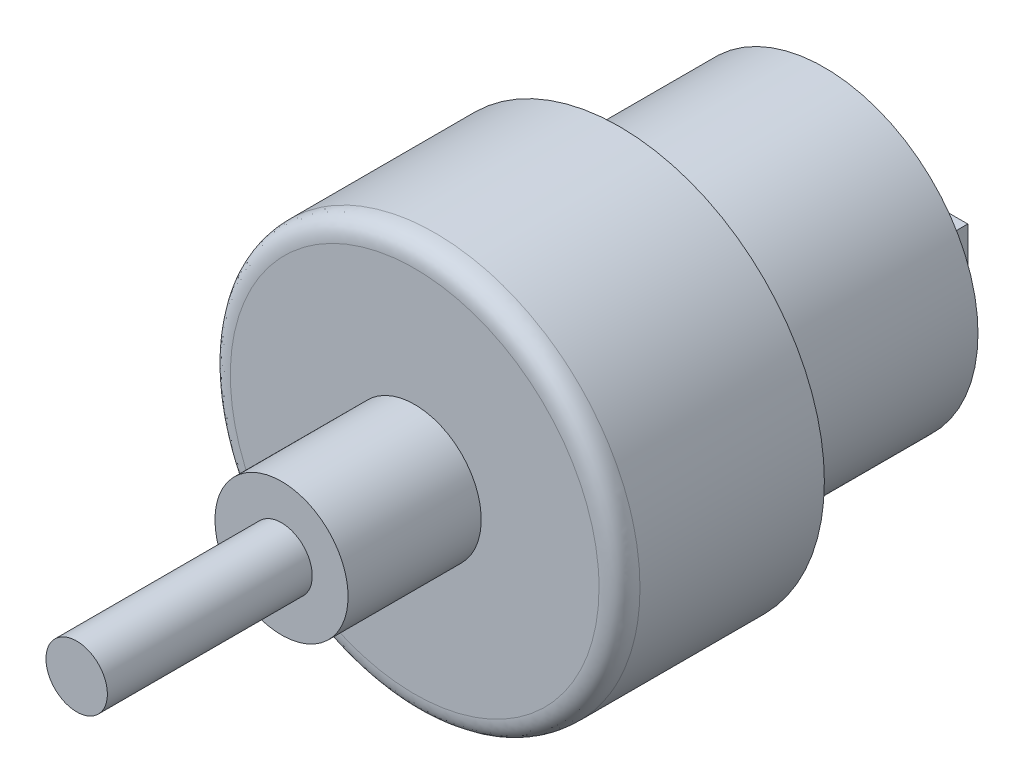
from build123d import *

# Parameters (mm, degrees)
SKETCH1_R           = 10
BOSS_EXTRUDE1_DEPTH = 10
SKETCH2_R           = 7.5
BOSS_EXTRUDE2_DEPTH = 10
SKETCH3_R           = 1.5
BOSS_EXTRUDE5_DEPTH = 3
SKETCH7_W           = 1
SKETCH7_H           = 5.758644492
BOSS_EXTRUDE7_DEPTH = 1.5
SKETCH8_R           = 3.25
BOSS_EXTRUDE8_DEPTH = 6.5
BOSS_EXTRUDE9_START = 10
SKETCH9_R           = 1.5
BOSS_EXTRUDE9_DEPTH = 10
FILLET2_SIZE        = 1


with BuildPart() as part:
    # Sketch1 → Boss-Extrude1 (new body)
    with BuildSketch(Plane.XY):
        Circle(SKETCH1_R)
    extrude(amount=BOSS_EXTRUDE1_DEPTH)

    # Sketch2 → Boss-Extrude2 (add)
    with BuildSketch(Plane(origin=(0, 0, 0), x_dir=(-1, 0, 0), z_dir=(0, 0, -1))):
        with Locations(Location((0, 0, 0), (0, 0, 180))):
            Circle(SKETCH2_R)
    extrude(amount=BOSS_EXTRUDE2_DEPTH)

    # Sketch3 → Boss-Extrude5 (add)
    with BuildSketch(Plane(origin=(0, 0, -10), x_dir=(-1, 0, 0), z_dir=(0, 0, -1))):
        Circle(SKETCH3_R)
    extrude(amount=BOSS_EXTRUDE5_DEPTH)

    # Sketch7 → Boss-Extrude7 (add)
    with BuildSketch(Plane(origin=(0, 0, -10), x_dir=(-1, 0, 0), z_dir=(0, 0, -1))):
        with Locations((-5, 0)):
            Rectangle(SKETCH7_W, SKETCH7_H)
        with Locations((5, 0)):
            Rectangle(SKETCH7_W, SKETCH7_H)
    extrude(amount=BOSS_EXTRUDE7_DEPTH)

    # Sketch8 → Boss-Extrude8 (add)
    with BuildSketch(Plane.XY.offset(10)):
        with Locations(Location((0, 0, 0), (0, 0, 180))):
            Circle(SKETCH8_R)
    extrude(amount=BOSS_EXTRUDE8_DEPTH)

    # Sketch9 → Boss-Extrude9 (add)
    with BuildSketch(Plane.XY.offset(16.5).offset(BOSS_EXTRUDE9_START)):
        with Locations(Location((0, 0, 0), (0, 0, 180))):
            Circle(SKETCH9_R)
    extrude(amount=-BOSS_EXTRUDE9_DEPTH)

    # Fillet2
    # a fillet whose section is not a circle: 1 mm, written as the material it takes off along each edge
    with BuildSketch(Plane(origin=(0, 0, 10), x_dir=(1, 0, 0), z_dir=(0, -1, 0))) as fillet2_piece_1:
        with BuildLine():
            Bezier((10, -FILLET2_SIZE), (10, 0), (10 - FILLET2_SIZE, 0), weights=[1, 1, 1])
            Line((10 - FILLET2_SIZE, 0), (10, 0))
            Line((10, 0), (10, -FILLET2_SIZE))
        make_face()
    revolve(axis=Axis((0, 0, 10), (0, 0, 1)), mode=Mode.SUBTRACT)


solid = part.part
